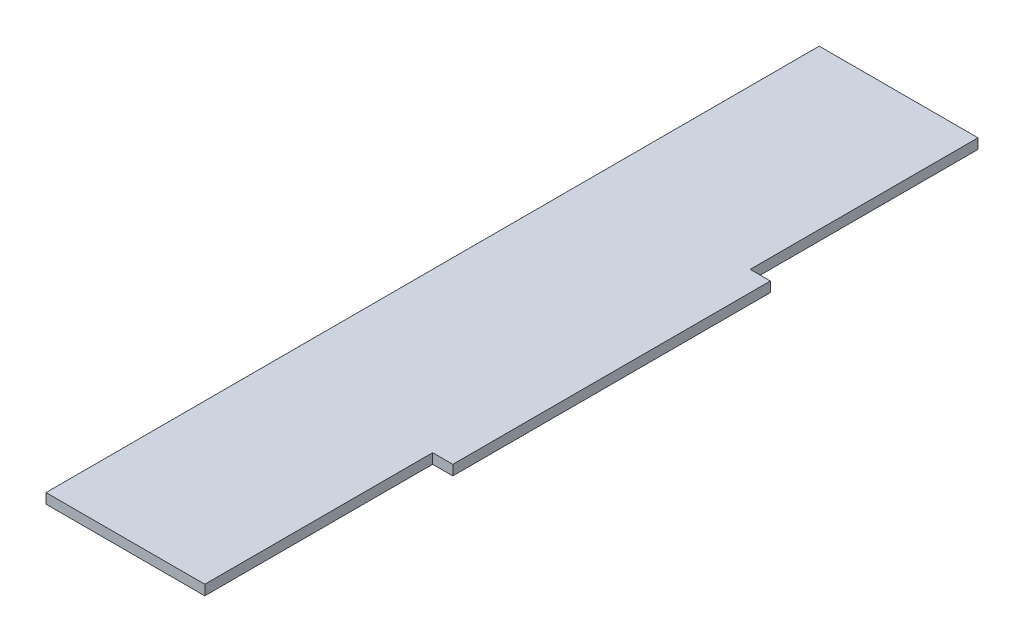
from build123d import *

# Parameters (mm, degrees)
BOSS_EXTRUDE1_DEPTH = 3.175


with BuildPart() as part:
    # Sketch1 → Boss-Extrude1 (new body)
    with BuildSketch(Plane(origin=(0, 0, 0), x_dir=(1, 0, 0), z_dir=(0, 1, 0))):
        Polygon((25, 71.75), (-25, 71.75), (-25, 0), (-25, -100), (-25, -171.75), (25, -171.75), (25, -100), (31.35, -100), (31.35, 0), (25, 0), align=None)
    extrude(amount=BOSS_EXTRUDE1_DEPTH)


solid = part.part
